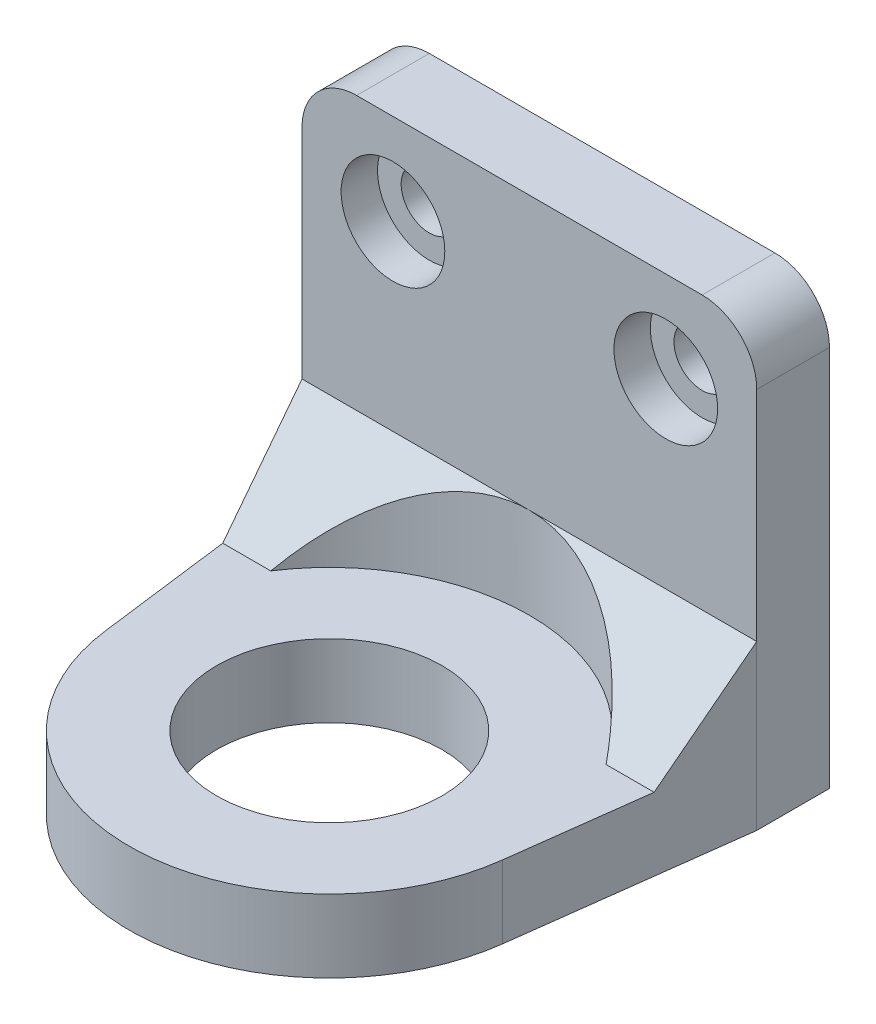
from build123d import *

# Parameters (mm, degrees)
SKETCH1_W           = 25
SKETCH1_H           = 10
SKETCH1_R           = 1.55
BOSS_EXTRUDE1_DEPTH = 4
SKETCH2_W           = 25
SKETCH2_H           = 4
BOSS_EXTRUDE2_DEPTH = 10
SKETCH3_R           = 6.2
BOSS_EXTRUDE3_DEPTH = 4
CHAMFER1_SIZE       = 5
CUT_EXTRUDE1_START  = 10
SKETCH4_R           = 11
CUT_EXTRUDE1_DEPTH  = 10
FILLET1_R           = 3
SKETCH5_R           = 2.85
CUT_EXTRUDE2_DEPTH  = 2


with BuildPart() as part:
    # Sketch1 → Boss-Extrude1 (new body)
    with BuildSketch(Plane.XY):
        with Locations((12.5, -30.5)):
            Rectangle(SKETCH1_W, SKETCH1_H)
        with Locations((5, -30.5)):
            Circle(SKETCH1_R, mode=Mode.SUBTRACT)
        with Locations((20, -30.5)):
            Circle(SKETCH1_R, mode=Mode.SUBTRACT)
    extrude(amount=BOSS_EXTRUDE1_DEPTH)

    # Sketch2 → Boss-Extrude2 (add)
    with BuildSketch(Plane.XZ.offset(35.5)):
        with Locations((12.5, 2)):
            Rectangle(SKETCH2_W, SKETCH2_H)
    extrude(amount=BOSS_EXTRUDE2_DEPTH)

    # Sketch3 → Boss-Extrude3 (add)
    with BuildSketch(Plane.XZ.offset(45.5)):
        with BuildLine():
            Line((0, 4), (1.589269612, 16.398557259))
            ThreePointArc((1.589269612, 16.398557259), (12.5, 26), (23.410730388, 16.398557259))
            Line((23.410730388, 16.398557259), (25, 4))
            Line((25, 4), (25, 0))
            Line((25, 0), (0, 0))
            Line((0, 0), (0, 4))
        make_face()
        with Locations(Location((12.5, 15, 0), (0, 0, 270))):
            Circle(SKETCH3_R, mode=Mode.SUBTRACT)
    extrude(amount=BOSS_EXTRUDE3_DEPTH)

    # Chamfer1
    # the kernel refuses this chamfer: 5 mm, written as the material it adds along each edge
    with BuildSketch(Plane(origin=(25, -45.5, 4), x_dir=(0, 0.9996219169112968, -0.027495876610586403), z_dir=(-1, 0, 0))) as chamfer1_piece_1_section:
        Polygon((CHAMFER1_SIZE * 0.999621916911, -CHAMFER1_SIZE * 0.0274958766106), (-CHAMFER1_SIZE * 0.0274958766106, -CHAMFER1_SIZE * 0.999621916911), (0, 0), align=None)
    chamfer1_piece_1 = extrude(amount=25, mode=Mode.PRIVATE)
    chamfer1_piece_1 = split(chamfer1_piece_1, bisect_by=Plane(origin=(24.592329288, -43.84115056, 7.18040981), z_dir=(-0.9918845807033364, 0, -0.12714156898106382)), keep=Keep.TOP, mode=Mode.PRIVATE)
    chamfer1_piece_1 = split(chamfer1_piece_1, bisect_by=Plane(origin=(0.407670712, -43.84115056, 7.18040981), z_dir=(0.9918845807033364, 0, -0.12714156898106413)), keep=Keep.TOP, mode=Mode.PRIVATE)
    chamfer1_piece_1 = chamfer1_piece_1 - Plane(origin=(12.5, -43.84115056, 15), x_dir=(0, 0, -1), z_dir=(0, 1, 0)) * Cylinder(6.2, 70, mode=Mode.PRIVATE)
    add(chamfer1_piece_1)

    # Sketch4 → Cut-Extrude1 (cut)
    with BuildSketch(Plane(origin=(0, -45.5, 0), x_dir=(1, 0, 0), z_dir=(0, 1, 0)).offset(CUT_EXTRUDE1_START)):
        with Locations((12.5, -15)):
            Circle(SKETCH4_R)
    extrude(amount=-CUT_EXTRUDE1_DEPTH, mode=Mode.SUBTRACT)

    # Fillet1
    fillet1_edges = [part.edges().sort_by_distance(p)[0] for p in [
        (25, -25.5, 2),
        (0, -25.5, 2),
    ]]
    fillet(fillet1_edges, radius=FILLET1_R)

    # Sketch5 → Cut-Extrude2 (cut)
    with BuildSketch(Plane.XY.offset(4)):
        with Locations((20, -30.5)):
            Circle(SKETCH5_R)
        with Locations((5, -30.5)):
            Circle(SKETCH5_R)
    extrude(amount=-CUT_EXTRUDE2_DEPTH, mode=Mode.SUBTRACT)


solid = part.part
